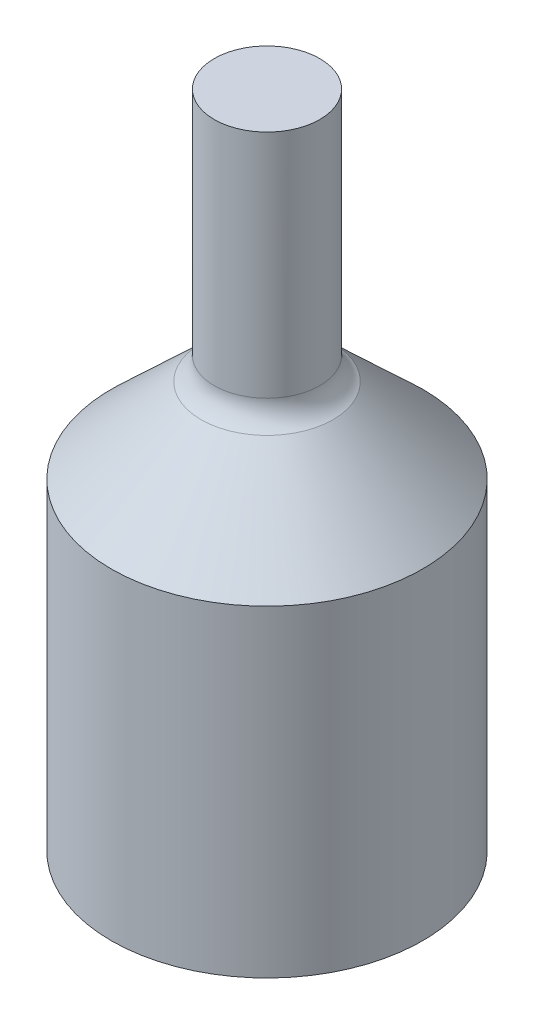
from build123d import *

# Parameters (mm, degrees)
SKETCH1_R           = 2.95
BOSS_EXTRUDE1_DEPTH = 7.7
SKETCH3_R           = 1
BOSS_EXTRUDE2_DEPTH = 4.8
FILLET1_R           = 0.5


with BuildPart() as part:
    # Sketch1 → Boss-Extrude1 (new body)
    with BuildSketch(Plane(origin=(0, 0, 0), x_dir=(1, 0, 0), z_dir=(0, 1, 0))):
        with Locations(Location((0, 0, 0), (0, 0, 90))):
            Circle(SKETCH1_R)
    extrude(amount=BOSS_EXTRUDE1_DEPTH)

    # Sketch2 → Cut-Revolve1 (revolve, cut)
    with BuildSketch(Plane.XY, mode=Mode.PRIVATE) as cut_revolve1_sk:
        Polygon((-2.95, 6.1), (-1.25, 7.7), (-2.95, 7.7), align=None)
    revolve(cut_revolve1_sk.sketch.rotate(Axis((0, 7.7, 0), (0, -1, 0)), 90), axis=Axis((0, 7.7, 0), (0, -1, 0)), mode=Mode.SUBTRACT)

    # Sketch3 → Boss-Extrude2 (add)
    with BuildSketch(Plane(origin=(0, 7.7, 0), x_dir=(1, 0, 0), z_dir=(0, 1, 0))):
        with Locations(Location((0, 0, 0), (0, 0, 270))):
            Circle(SKETCH3_R)
    extrude(amount=BOSS_EXTRUDE2_DEPTH)

    # Fillet1
    # the kernel refuses this fillet: 0.5 mm, written as the material it adds along each edge
    with BuildSketch(Plane(origin=(0, 7.7, 0), x_dir=(0, 0, 1), z_dir=(-1, 0, 0))) as fillet1_piece_1:
        with BuildLine():
            CenterArc((1.5, 0.433012702), FILLET1_R, 180, 60)
            Line((1, 0.433012702), (0.99, 0.433012702))
            Line((0.99, 0.433012702), (0.99, 0))
            Line((0.99, 0), (1, -0.01))
            ThreePointArc((1, -0.01), (1.125, -0.01), (1.245, -0.008660254))
            Line((1.245, -0.008660254), (1.25, 0))
        make_face()
    revolve(axis=Axis((0, 7.7, 0), (0, 1, 0)))


solid = part.part
